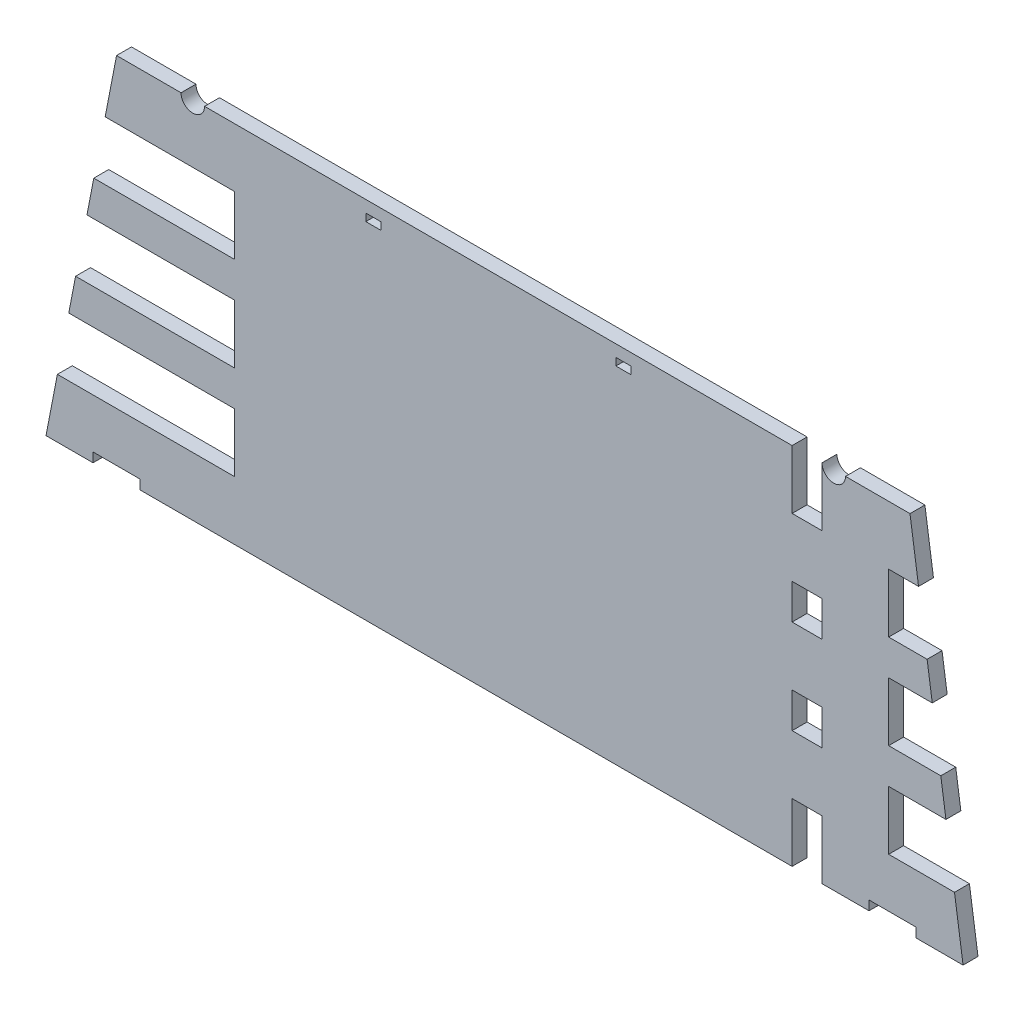
from build123d import *

# Parameters (mm, degrees)
SKETCH1_W      = 12.7
SKETCH1_H      = 15
SKETCH1_W_2    = 6.35
SKETCH1_H_2    = 3.175
EXTRUDE1_DEPTH = 6.35


with BuildPart() as part:
    # Sketch1 → Extrude1 (new body)
    with BuildSketch(Plane.XY):
        with BuildLine():
            Line((-152.3625, 4), (-152.3625, 0))
            Line((-152.3625, 0), (124.9375, 0))
            Line((124.9375, 0), (124.9375, 25))
            Line((124.9375, 25), (137.6375, 25))
            Line((137.6375, 25), (137.6375, 0))
            Line((137.6375, 0), (157.6375, 0))
            Line((157.6375, 0), (157.6375, 4))
            Line((157.6375, 4), (177.6375, 4))
            Line((177.6375, 4), (177.6375, 0))
            Line((177.6375, 0), (197.6375, 0))
            Line((197.6375, 0), (193.996370968, 25))
            Line((193.996370968, 25), (166.003629032, 25))
            Line((166.003629032, 25), (166.003629032, 50))
            Line((166.003629032, 50), (190.355241935, 50))
            Line((190.355241935, 50), (188.170564516, 65))
            Line((188.170564516, 65), (166.003629032, 65))
            Line((166.003629032, 65), (166.003629032, 90))
            Line((166.003629032, 90), (184.529435484, 90))
            Line((184.529435484, 90), (182.344758065, 105))
            Line((182.344758065, 105), (166.003629032, 105))
            Line((166.003629032, 105), (166.003629032, 130))
            Line((166.003629032, 130), (178.703629032, 130))
            Line((178.703629032, 130), (175.0625, 155))
            Line((175.0625, 155), (147.6375, 155))
            ThreePointArc((147.6375, 155), (142.6375, 150), (137.6375, 155))
            Line((137.6375, 155), (137.6375, 130))
            Line((137.6375, 130), (124.9375, 130))
            Line((124.9375, 130), (124.9375, 155))
            Line((124.9375, 155), (-124.9375, 155))
            ThreePointArc((-124.9375, 155), (-129.9375, 150), (-134.9375, 155))
            Line((-134.9375, 155), (-162.3625, 155))
            Line((-162.3625, 155), (-167.201209677, 130))
            Line((-167.201209677, 130), (-112.2375, 130))
            Line((-112.2375, 130), (-112.2375, 105))
            Line((-112.2375, 105), (-172.039919355, 105))
            Line((-172.039919355, 105), (-174.943145161, 90))
            Line((-174.943145161, 90), (-112.2375, 90))
            Line((-112.2375, 90), (-112.2375, 65))
            Line((-112.2375, 65), (-179.781854839, 65))
            Line((-179.781854839, 65), (-182.685080645, 50))
            Line((-182.685080645, 50), (-112.2375, 50))
            Line((-112.2375, 50), (-112.2375, 25))
            Line((-112.2375, 25), (-187.523790323, 25))
            Line((-187.523790323, 25), (-192.3625, 0))
            Line((-192.3625, 0), (-172.3625, 0))
            Line((-172.3625, 0), (-172.3625, 4))
            Line((-172.3625, 4), (-152.3625, 4))
        make_face()
        with Locations((131.2875, 57.5)):
            Rectangle(SKETCH1_W, SKETCH1_H, mode=Mode.SUBTRACT)
        with Locations((-53.175, 148.4125)):
            Rectangle(SKETCH1_W_2, SKETCH1_H_2, mode=Mode.SUBTRACT)
        with Locations((131.2875, 97.5)):
            Rectangle(SKETCH1_W, SKETCH1_H, mode=Mode.SUBTRACT)
        with Locations((53.175, 148.4125)):
            Rectangle(SKETCH1_W_2, SKETCH1_H_2, mode=Mode.SUBTRACT)
    extrude(amount=EXTRUDE1_DEPTH)


solid = part.part
